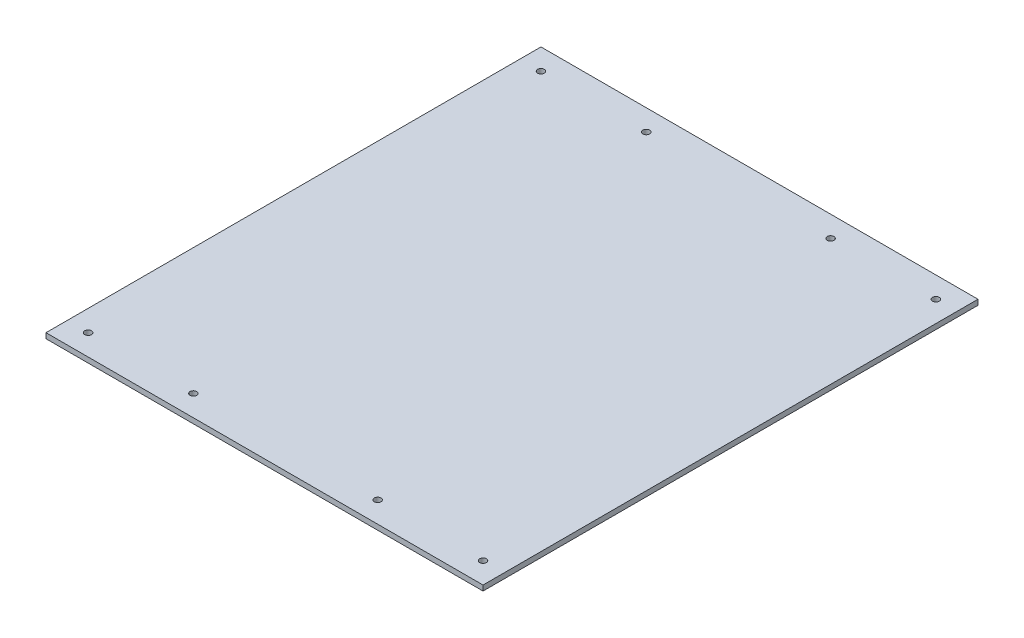
from build123d import *

# Parameters (mm, degrees)
SKETCH1_W                = 415
SKETCH1_H                = 470
BOSS_EXTRUDE1_DEPTH      = 5
M6_CLEARANCE_HOLE1_D     = 6.4
M6_CLEARANCE_HOLE1_DEPTH = 10
M6_CLEARANCE_HOLE1_TIP   = 1.922753981


with BuildPart() as part:
    # Sketch1 → Boss-Extrude1 (new body)
    with BuildSketch(Plane(origin=(0, 0, 0), x_dir=(1, 0, 0), z_dir=(0, 1, 0))):
        Rectangle(SKETCH1_W, SKETCH1_H)
    extrude(amount=BOSS_EXTRUDE1_DEPTH)

    # M6 Clearance Hole1
    with Locations(Plane(origin=(0, 5, 0), x_dir=(1, 0, 0), z_dir=(0, 1, 0))):
        with Locations((-187.5, 215), (-87.5, 215), (87.5, 215), (187.5, 215), (-187.5, -215), (-87.5, -215), (87.5, -215), (187.5, -215)):
            Hole(M6_CLEARANCE_HOLE1_D / 2, depth=M6_CLEARANCE_HOLE1_DEPTH)
            with Locations((0, 0, -(M6_CLEARANCE_HOLE1_DEPTH + M6_CLEARANCE_HOLE1_TIP / 2))):  # 118° drill point
                Cone(0, M6_CLEARANCE_HOLE1_D / 2, M6_CLEARANCE_HOLE1_TIP, mode=Mode.SUBTRACT)


solid = part.part
